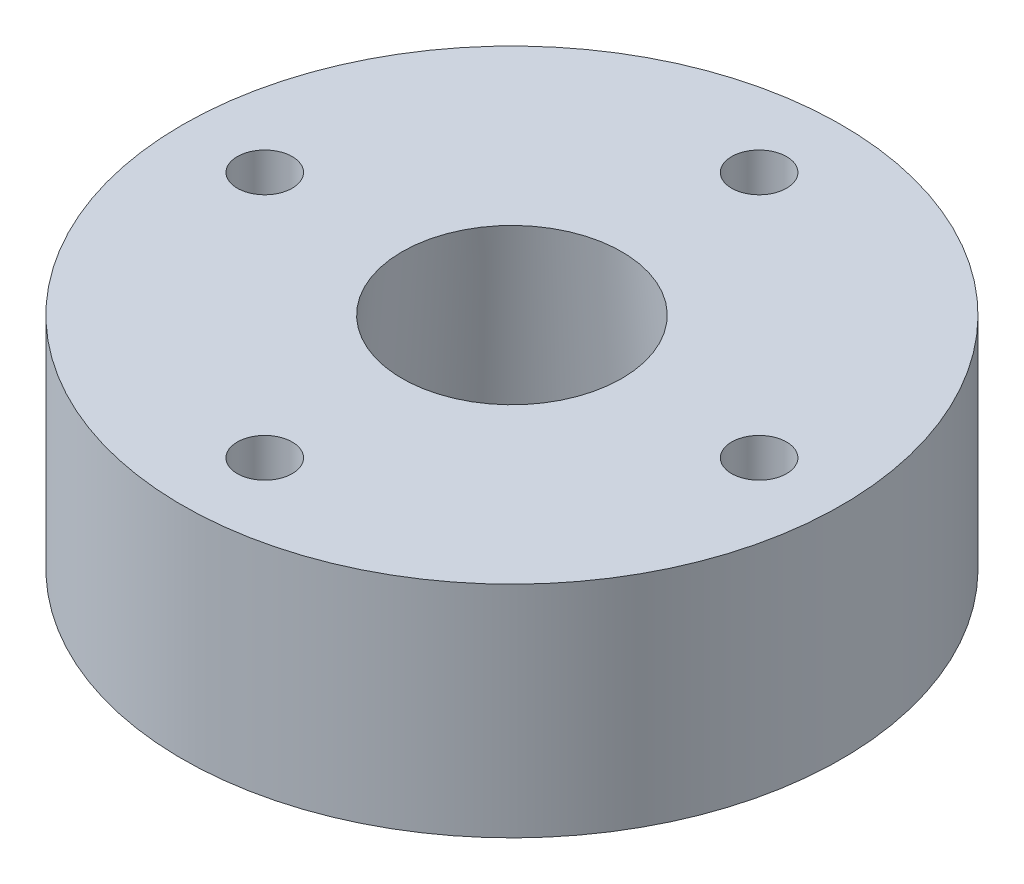
from build123d import *

# Parameters (mm, degrees)
FILLET1_R          = 2
SKETCH3_R          = 3.175
CUT_EXTRUDE1_DEPTH = 74.231772476


with BuildPart() as part:
    # Sketch2 → Revolve2 (revolve)
    with BuildSketch(Plane.XY):
        Polygon((19.05, -12.7), (-2.29475363, -12.7), (-2.320408163, -12.7), (-4.320233699, -10.701915819), (-6.35, 12.7), (19.05, 12.7), align=None)
    revolve(axis=Axis((-19.05, 12.7, 0), (0, -1, 0)))

    # Fillet1
    fillet1_edges = [part.edges().sort_by_distance(p)[0] for p in [
        (-33.779766301, -10.701915819, 0),
        (-35.779591837, -12.7, 0),
    ]]
    fillet(fillet1_edges, radius=FILLET1_R)

    # Sketch3 → Cut-Extrude1 (cut, through all)
    with BuildSketch(Plane(origin=(0, 12.7, 0), x_dir=(1, 0, 0), z_dir=(0, 1, 0))):
        with Locations((-19.05, 28.575)):
            Circle(SKETCH3_R)
        with Locations((9.525, 0)):
            Circle(SKETCH3_R)
        with Locations((-19.05, -28.575)):
            Circle(SKETCH3_R)
        with Locations((-47.625, 0)):
            Circle(SKETCH3_R)
    extrude(amount=-CUT_EXTRUDE1_DEPTH, mode=Mode.SUBTRACT)


solid = part.part
